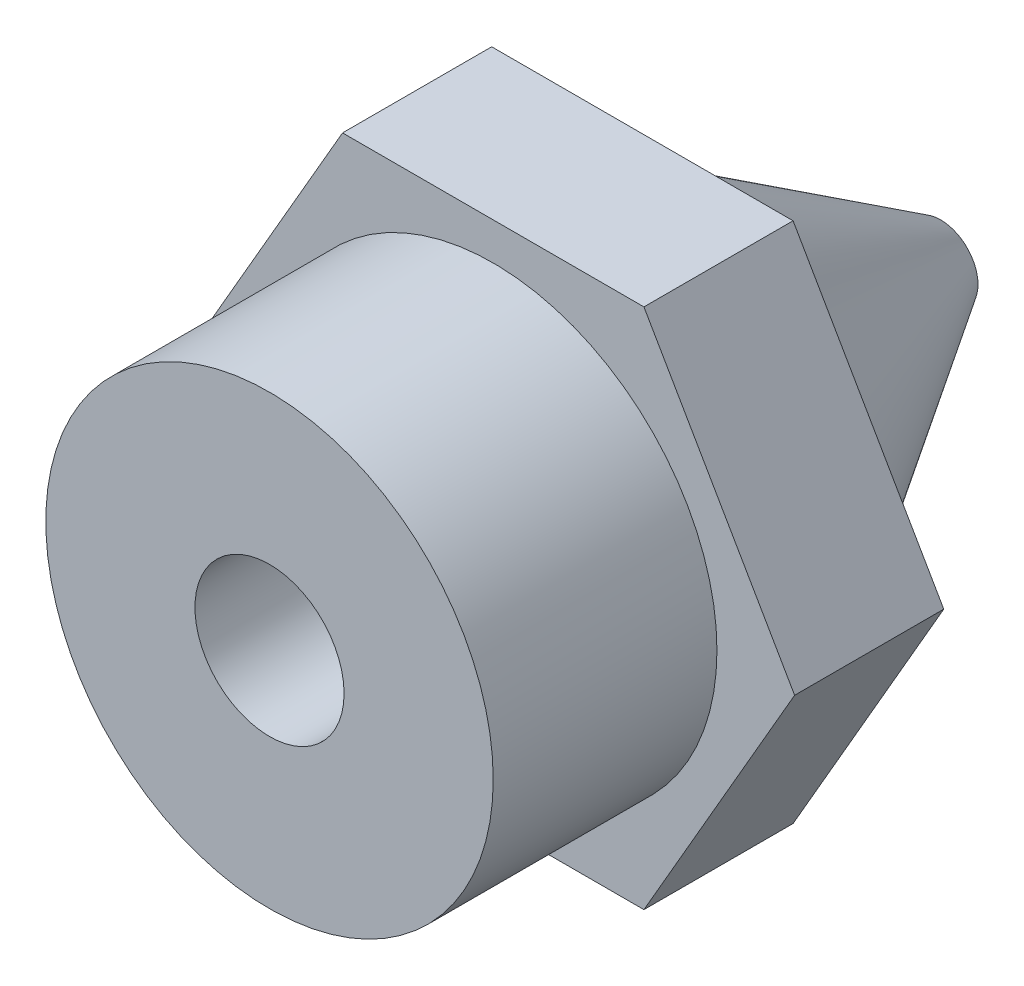
from build123d import *

# Parameters (mm, degrees)
BOSS_EXTRU_1_DEPTH      = 9
ESQUISSE2_W             = 19.623971562
ESQUISSE2_H             = 15.534154535
ESQUISSE2_R             = 3
ENL_V_MAT_EXTRU_1_DEPTH = 3
ENL_V_START             = -4
ESQUISSE3_W             = 11.267201257
ESQUISSE3_H             = 13.961169169
ESQUISSE3_R             = 3
ENL_V_MAT_EXTRU_2_DEPTH = 4
CHANFREIN1_SIZE         = 4
CHANFREIN1_SIZE_2       = 2.499477408


with BuildPart() as part:
    # Esquisse1 → Boss.-Extru.1 (new body)
    with BuildSketch(Plane.XY):
        Polygon((4.041451884, 0), (2.020725942, 3.5), (-2.020725942, 3.5), (-4.041451884, 0), (-2.020725942, -3.5), (2.020725942, -3.5), align=None)
    extrude(amount=BOSS_EXTRU_1_DEPTH)

    # Esquisse2 → Enlèv. mat.-Extru.1 (cut)
    with BuildSketch(Plane.XY.offset(9)):
        with Locations((0.327116653, -1.544441398)):
            Rectangle(ESQUISSE2_W, ESQUISSE2_H)
        Circle(ESQUISSE2_R, mode=Mode.SUBTRACT)
    extrude(amount=-ENL_V_MAT_EXTRU_1_DEPTH, mode=Mode.SUBTRACT)

    # Esquisse3 → Enlèv. mat.-Extru.2 (cut)
    with BuildSketch(Plane(origin=(0, 0, 0), x_dir=(-1, 0, 0), z_dir=(0, 0, -1)).offset(ENL_V_START)):
        with Locations((0.009770186, 0.039262349)):
            Rectangle(ESQUISSE3_W, ESQUISSE3_H)
        with Locations(Location((0, 0, 0), (0, 0, 180))):
            Circle(ESQUISSE3_R, mode=Mode.SUBTRACT)
    extrude(amount=ENL_V_MAT_EXTRU_2_DEPTH, mode=Mode.SUBTRACT)

    # Chanfrein1
    # the kernel refuses this chamfer: 4, 2.499477408 mm, written as the material it takes off along each edge
    with BuildSketch(Plane(origin=(0, 0, 0), x_dir=(1, 0, 0), z_dir=(0, 1, 0))) as chanfrein1_piece_1_section:
        Polygon((3, -CHANFREIN1_SIZE), (3 - CHANFREIN1_SIZE_2, 0), (3, 0), align=None)
    chanfrein1_piece_1 = revolve(axis=Axis((0, 0, 0), (0, 0, -1)), mode=Mode.PRIVATE)
    chanfrein1_piece_1 = split(chanfrein1_piece_1, bisect_by=Plane(origin=(-1.744026904, 0, 4), z_dir=(0, 0, -1)), keep=Keep.TOP, mode=Mode.PRIVATE)
    add(chanfrein1_piece_1, mode=Mode.SUBTRACT)

    # Esquisse4 → Enlèvement de matière-Révolution1 (revolve, cut)
    with BuildSketch(Plane(origin=(0, 0, 0), x_dir=(1, 0, 0), z_dir=(0, 1, 0))):
        Polygon((0, -9), (1, -9), (1, -6.922694464), (0.15, 0), (0, 0), align=None)
    revolve(axis=Axis((0, 0, 10.381605157), (0, 0, -1)), mode=Mode.SUBTRACT)


solid = part.part
